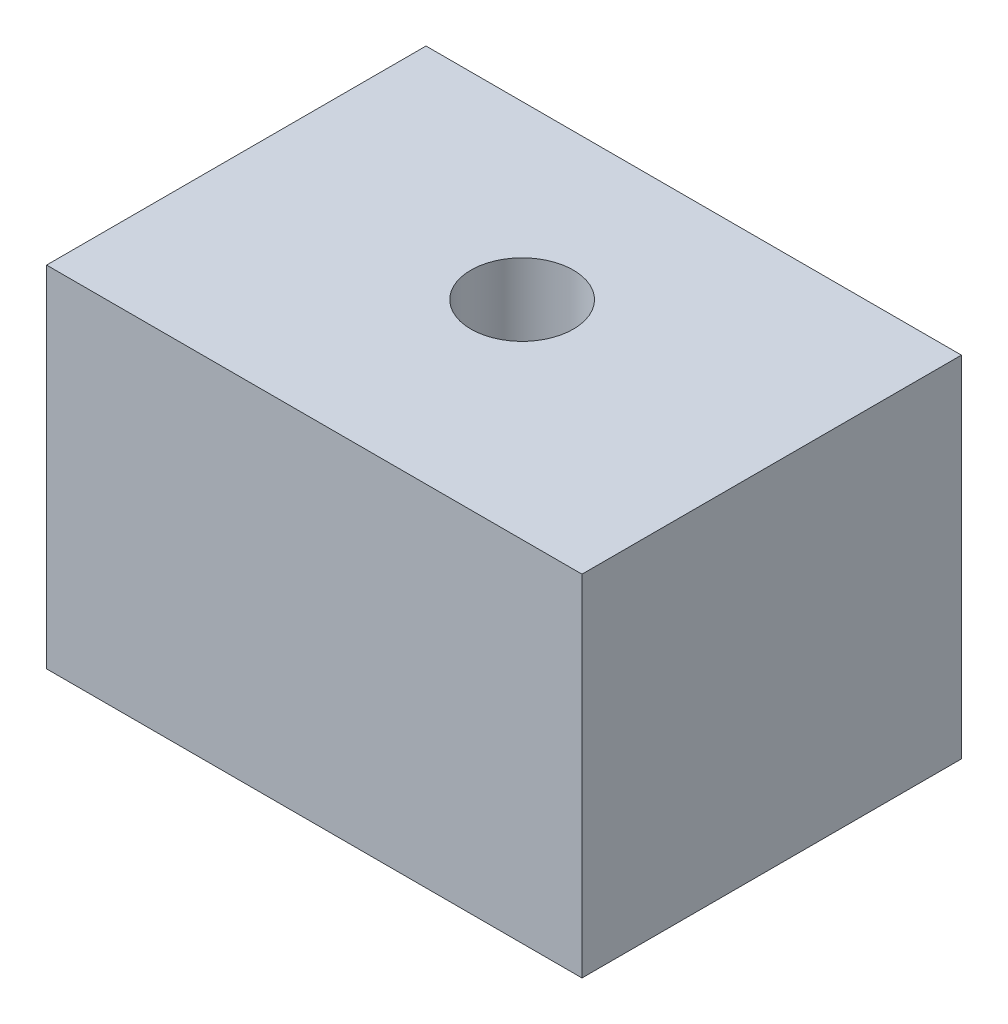
from build123d import *

# Parameters (mm, degrees)
SKETCH4_W           = 70.55566623
SKETCH4_H           = 46.087100556
BOSS_EXTRUDE1_DEPTH = 50


# Read off the part's stored shape, not the designer's step: AdvancedHole2
with BuildPart() as part:
    # Sketch4 → Boss-Extrude1 (new body)
    with BuildSketch(Plane.XY):
        Rectangle(SKETCH4_W, SKETCH4_H)
    extrude(amount=BOSS_EXTRUDE1_DEPTH)

    # AdvancedHole2 outline → AdvancedHole2 (revolve, cut)
    with BuildSketch(Plane.XY.offset(22.608820769)):
        Polygon((3.570986, 11.613550278), (6.746875, 11.613550278), (6.746875, 23.043550278), (0, 23.043550278), (0, -23.043550278), (2.5273, -23.043550278), (2.5273, 4.727610278), (3.356012175, 4.727610278), align=None)
    revolve(axis=Axis((0, 0, 22.608820769), (0, 1, 0)), mode=Mode.SUBTRACT)


solid = part.part
